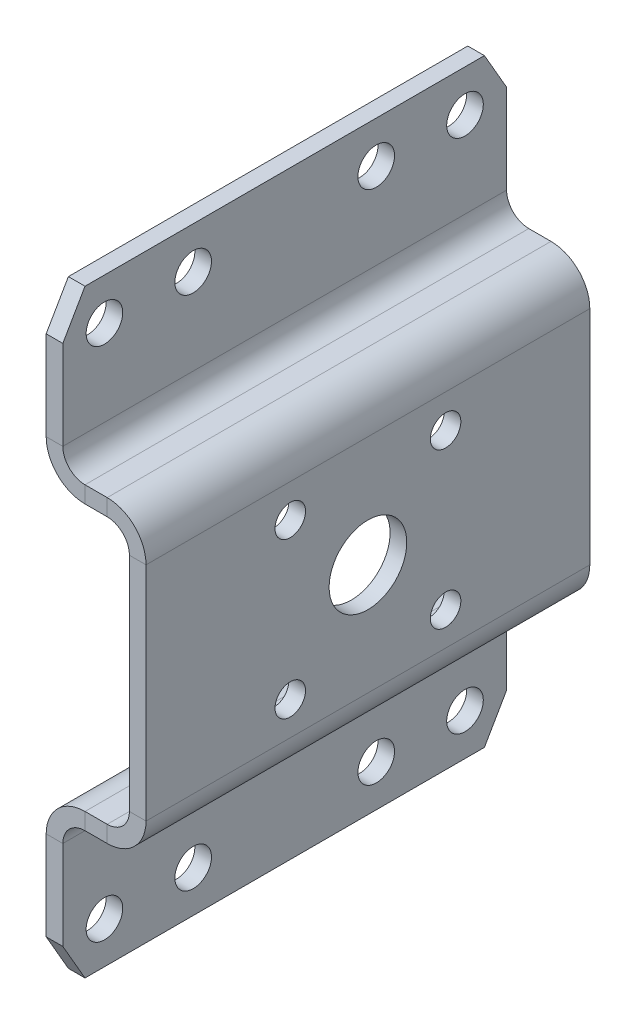
from build123d import *
from OCP.BRepFilletAPI import BRepFilletAPI_MakeChamfer

# Parameters (mm, degrees)
ODGI_CIE_BAZOWE1_DEPTH     = 40
OTW_R_POD_RUB_M51_D        = 5.5
SZKIC4_R                   = 7
WYTNIJ_WYCI_GNI_CIE1_DEPTH = 69.85491994
OTW_R_POD_RUB_M61_D        = 6.6
SFAZOWANIE1_SIZE           = 4
SFAZOWANIE1_SIZE2          = 6.92820323


# Sheet-metal steps are written as plain solids
with BuildPart() as part:
    # Szkic1 → Odgięcie bazowe1 (new, symmetric)
    with BuildSketch(Plane.XY):
        with BuildLine():
            Line((-15, 54), (-15, 31))
            ThreePointArc((-15, 31), (-12.949747468, 26.050252532), (-8, 24))
            Line((-8, 24), (-4, 24))
            ThreePointArc((-4, 24), (-1.171572875, 22.828427125), (0, 20))
            Line((0, 20), (0, -20))
            ThreePointArc((0, -20), (-1.171572875, -22.828427125), (-4, -24))
            Line((-4, -24), (-8, -24))
            ThreePointArc((-8, -24), (-12.949747468, -26.050252532), (-15, -31))
            Line((-15, -31), (-15, -54))
            Line((-15, -54), (-12, -54))
            Line((-12, -54), (-12, -31))
            ThreePointArc((-12, -31), (-10.828427125, -28.171572875), (-8, -27))
            Line((-8, -27), (-4, -27))
            ThreePointArc((-4, -27), (0.949747468, -24.949747468), (3, -20))
            Line((3, -20), (3, 20))
            ThreePointArc((3, 20), (0.949747468, 24.949747468), (-4, 27))
            Line((-4, 27), (-8, 27))
            ThreePointArc((-8, 27), (-10.828427125, 28.171572875), (-12, 31))
            Line((-12, 31), (-12, 54))
            Line((-12, 54), (-15, 54))
        make_face()
    extrude(amount=ODGI_CIE_BAZOWE1_DEPTH, both=True)

    # Otwór pod śrubę M51 (through all)
    with Locations(Plane.ZY):
        with Locations((-14, 14), (14, 14), (14, -14), (-14, -14)):
            Hole(OTW_R_POD_RUB_M51_D / 2)

    # Szkic4 → Wytnij-wyciągnięcie1 (cut, through all)
    with BuildSketch(Plane.ZY):
        Circle(SZKIC4_R)
    extrude(amount=-WYTNIJ_WYCI_GNI_CIE1_DEPTH, mode=Mode.SUBTRACT)

    # Otwór pod śrubę M61 (through all)
    with Locations(Plane(origin=(-12, 0, 0), x_dir=(0, 0, -1), z_dir=(1, 0, 0))):
        with Locations((-32.50000905, 46.5), (-16.50000905, 46.5), (16.5, 46.5), (32.5, 46.5), (32.5, -46.5), (16.5, -46.5), (-16.49999095, -46.5), (-32.49999095, -46.5)):
            Hole(OTW_R_POD_RUB_M61_D / 2)

    # Sfazowanie1: one chamfer whose edges measure the first distance from different faces: ONE call of the kernel's chamfer builder (chamfer() names one face for all edges)
    sfazowanie1_edges_1 = [part.edges().sort_by_distance(p)[0] for p in [
        (-13.5, -54, -40),
        (-13.5, -54, 40),
    ]]
    sfazowanie1_side_1 = [part.faces().sort_by_distance(p)[0] for p in [
        (-13.5, -54, 0),
    ]]
    sfazowanie1_edges_2 = [part.edges().sort_by_distance(p)[0] for p in [
        (-13.5, 54, -40),
        (-13.5, 54, 40),
    ]]
    sfazowanie1_side_2 = [part.faces().sort_by_distance(p)[0] for p in [
        (-13.5, 54, 0),
    ]]
    sfazowanie1 = BRepFilletAPI_MakeChamfer(part.part.solid().wrapped)
    for e in sfazowanie1_edges_1:
        sfazowanie1.Add(SFAZOWANIE1_SIZE, SFAZOWANIE1_SIZE2, e.wrapped, sfazowanie1_side_1[0].wrapped)  # the first distance lies on this face
    for e in sfazowanie1_edges_2:
        sfazowanie1.Add(SFAZOWANIE1_SIZE, SFAZOWANIE1_SIZE2, e.wrapped, sfazowanie1_side_2[0].wrapped)  # the first distance lies on this face
    add(Compound.cast(sfazowanie1.Shape()), mode=Mode.REPLACE)


solid = part.part
